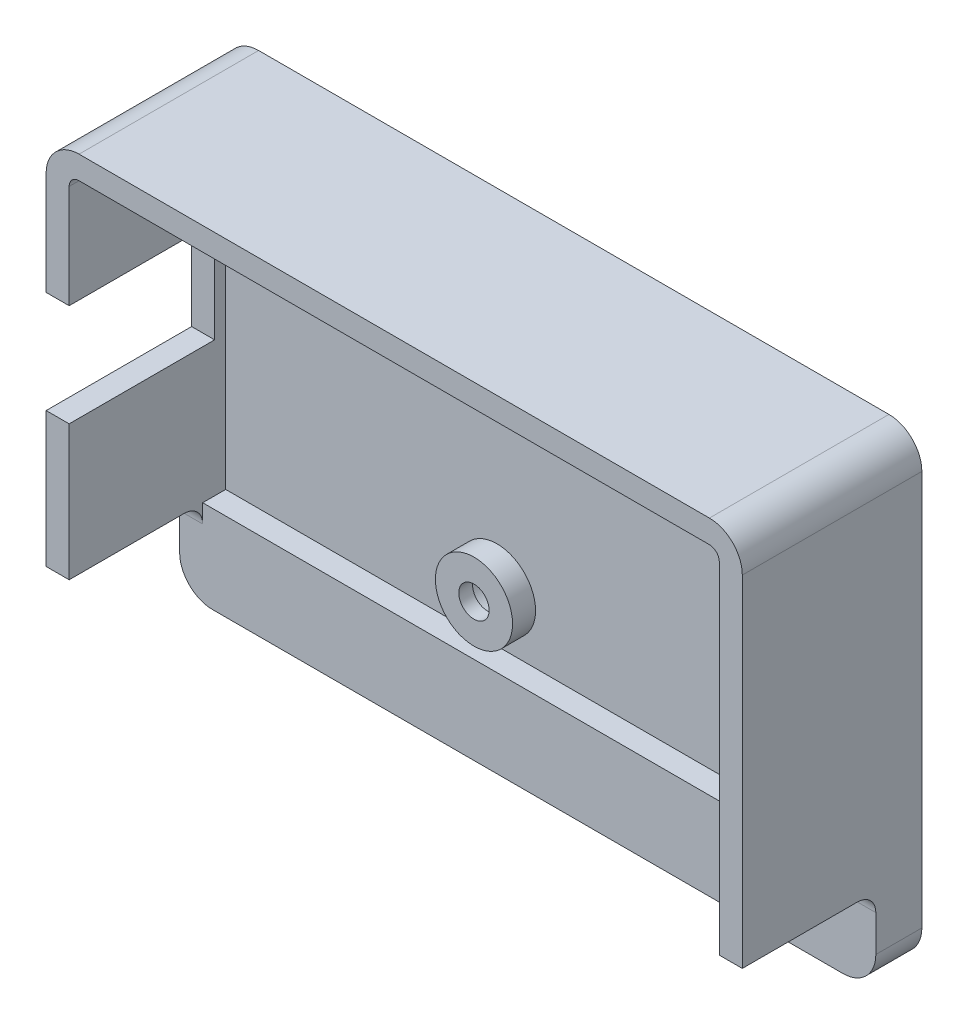
from build123d import *

# Parameters (mm, degrees)
EXTRUDE_1_DEPTH                 = 17
SHELL_1_T                       = 2.5
SKETCH_5_R                      = 4.191
EXTRUDE_2_DEPTH                 = 2.5
CUT_EXTRUDE_1_REACH             = 54.251
SKETCH_6_R                      = 2.7083489
CUT_EXTRUDE_1_DIRECTION_2_DEPTH = 1
CUT_EXTRUDE_2_DEPTH             = 53.251002733
CUT_EXTRUDE_2_DEPTH_BACK        = 53.251002733
SKETCH_7_R                      = 1.65
SKETCH_8_W                      = 15.8
SKETCH_8_H                      = 11.108258221
CUT_EXTRUDE_3_DEPTH             = 3
CUT_EXTRUDE_4_REACH             = 54.251
SKETCH_9_W                      = 75.61
SKETCH_9_H                      = 9.514536
EXTRUDE_3_DEPTH                 = 2.5
FILLET_1_R                      = 2


with BuildPart() as part:
    # 草图4 → 凸台-拉伸1 (new body)
    with BuildSketch(Plane.XY):
        with BuildLine():
            Line((32.164875784, -18.408833444), (-36.295124216, -18.408833444))
            ThreePointArc((-36.295124216, -18.408833444), (-37.055264006, -18.093973234), (-37.370124216, -17.333833444))
            Line((-37.370124216, -17.333833444), (-37.370124216, 25.606166556))
            ThreePointArc((-37.370124216, 25.606166556), (-37.055264006, 26.366306345), (-36.295124216, 26.681166556))
            Line((-36.295124216, 26.681166556), (32.164875784, 26.681166556))
            ThreePointArc((32.164875784, 26.681166556), (32.925015574, 26.366306345), (33.239875784, 25.606166556))
            Line((33.239875784, 25.606166556), (33.239875784, -17.333833444))
            ThreePointArc((33.239875784, -17.333833444), (32.925015574, -18.093973234), (32.164875784, -18.408833444))
        make_face()
    extrude(amount=EXTRUDE_1_DEPTH)

    # 抽壳1
    shell_1_openings = [part.faces().sort_by_distance(p)[0] for p in [
        (-2.065124216, 4.136166556, 17),
    ]]
    offset(amount=SHELL_1_T, openings=shell_1_openings, kind=Kind.INTERSECTION)

    # 草图5 → 凸台-拉伸2 (add)
    with BuildSketch(Plane.XY):
        with Locations((28.796875784, 22.485238556)):
            Circle(SKETCH_5_R)
        with Locations((-7.906124216, -5.962761444)):
            Circle(SKETCH_5_R)
    extrude(amount=EXTRUDE_2_DEPTH)

    # 草图6 → 切除-拉伸1 (cut, up to next)
    with BuildSketch(Plane.XY, mode=Mode.PRIVATE) as cut_extrude_1_sk1:
        with Locations((-7.906124216, -5.962761444)):
            Circle(SKETCH_6_R)
    cut_extrude_1_tool1 = extrude(cut_extrude_1_sk1.sketch, amount=-CUT_EXTRUDE_1_REACH, mode=Mode.PRIVATE) & part.part
    # 草图6 → 切除-拉伸1 (cut, up to next)
    with BuildSketch(Plane.XY, mode=Mode.PRIVATE) as cut_extrude_1_sk2:
        with Locations((28.796875784, 22.485238556)):
            Circle(SKETCH_6_R)
    cut_extrude_1_tool2 = extrude(cut_extrude_1_sk2.sketch, amount=-CUT_EXTRUDE_1_REACH, mode=Mode.PRIVATE) & part.part
    add(cut_extrude_1_tool1.solids().sort_by_distance((-7.906124, -5.962761, 0))[0], mode=Mode.SUBTRACT)
    add(cut_extrude_1_tool2.solids().sort_by_distance((28.796876, 22.485239, 0))[0], mode=Mode.SUBTRACT)

    # 草图6 → 切除-拉伸1 direction 2 (cut)
    with BuildSketch(Plane.XY):
        with Locations((-7.906124216, -5.962761444)):
            Circle(SKETCH_6_R)
        with Locations((28.796875784, 22.485238556)):
            Circle(SKETCH_6_R)
    extrude(amount=CUT_EXTRUDE_1_DIRECTION_2_DEPTH, mode=Mode.SUBTRACT)

    # 草图7 → 切除-拉伸2 (cut, two sides: drawn at the far end of the back side and taken through both)
    with BuildSketch(Plane.XY.offset(-CUT_EXTRUDE_2_DEPTH_BACK)):
        with Locations((-7.906124216, -5.962761444)):
            Circle(SKETCH_7_R)
        with Locations((28.796875784, 22.485238556)):
            Circle(SKETCH_7_R)
    extrude(amount=CUT_EXTRUDE_2_DEPTH + CUT_EXTRUDE_2_DEPTH_BACK, mode=Mode.SUBTRACT)

    # 草图8 → 切除-拉伸3 (cut)
    with BuildSketch(Plane.ZY.offset(39.870124216)):
        with Locations((9.1, 8.830545142)):
            Rectangle(SKETCH_8_W, SKETCH_8_H)
    extrude(amount=-CUT_EXTRUDE_3_DEPTH, mode=Mode.SUBTRACT)

    # 草图9 → 切除-拉伸4 (cut, up to next)
    with BuildSketch(Plane.XY, mode=Mode.PRIVATE) as cut_extrude_4_sk1:
        with Locations((-2.065124216, -16.151565444)):
            Rectangle(SKETCH_9_W, SKETCH_9_H)
    cut_extrude_4_tool1 = extrude(cut_extrude_4_sk1.sketch, amount=CUT_EXTRUDE_4_REACH, mode=Mode.PRIVATE) & part.part
    add(cut_extrude_4_tool1.solids().sort_by_distance((-2.065124, -16.151565, 0))[0], mode=Mode.SUBTRACT)

    # 草图10 → 凸台-拉伸3 (add)
    with BuildSketch(Plane.XY):
        with BuildLine():
            Line((-39.870124216, -11.394297444), (35.739875784, -11.394297444))
            Line((35.739875784, -11.394297444), (35.739875784, -17.333833444))
            ThreePointArc((35.739875784, -17.333833444), (34.692782527, -19.861740187), (32.164875784, -20.908833444))
            Line((32.164875784, -20.908833444), (-36.295124216, -20.908833444))
            ThreePointArc((-36.295124216, -20.908833444), (-38.823030959, -19.861740187), (-39.870124216, -17.333833444))
            Line((-39.870124216, -17.333833444), (-39.870124216, -11.394297444))
        make_face()
    extrude(amount=EXTRUDE_3_DEPTH)

    # 圆角1
    fillet_1_edges = [part.edges().sort_by_distance(p)[0] for p in [
        (34.489875784, -11.394297444, 2.5),
        (-38.620124216, -11.394297444, 2.5),
    ]]
    fillet(fillet_1_edges, radius=FILLET_1_R)


solid = part.part
